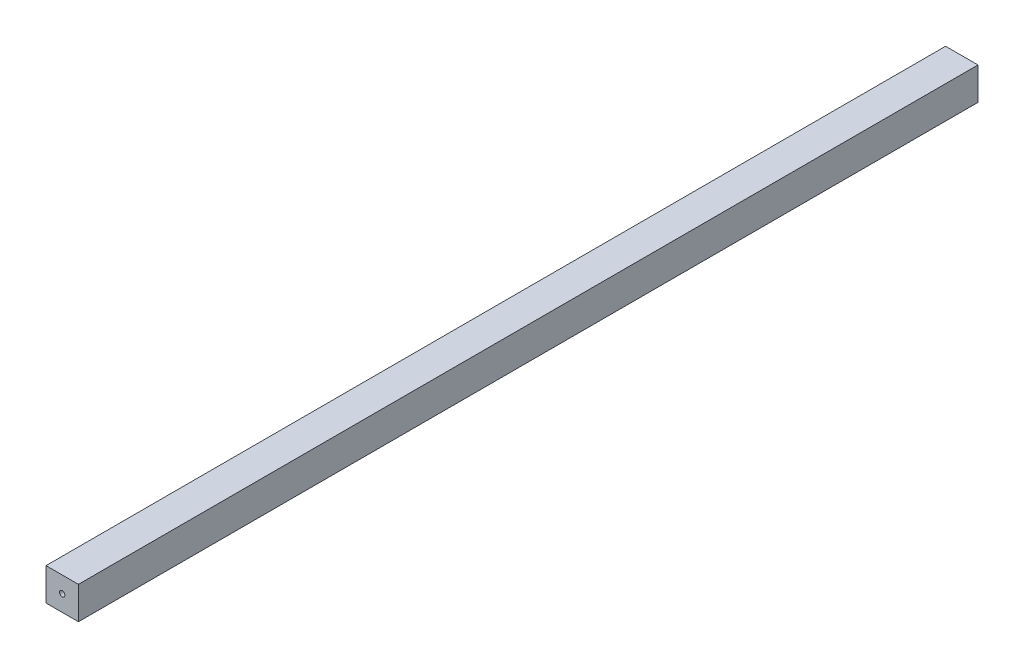
from build123d import *

# Parameters (mm, degrees)
SKETCH1_W           = 25.4
SKETCH1_H           = 25.4
BOSS_EXTRUDE1_DEPTH = 352.425
SKETCH2_R           = 2.0828
CUT_EXTRUDE1_DEPTH  = 812.292


with BuildPart() as part:
    # Sketch1 → Boss-Extrude1 (new, symmetric)
    with BuildSketch(Plane.XY):
        Rectangle(SKETCH1_W, SKETCH1_H)
    extrude(amount=BOSS_EXTRUDE1_DEPTH, both=True)

    # Sketch2 → Cut-Extrude1 (cut)
    with BuildSketch(Plane.XY.offset(352.425)):
        Circle(SKETCH2_R)
    extrude(amount=-CUT_EXTRUDE1_DEPTH, mode=Mode.SUBTRACT)


solid = part.part
